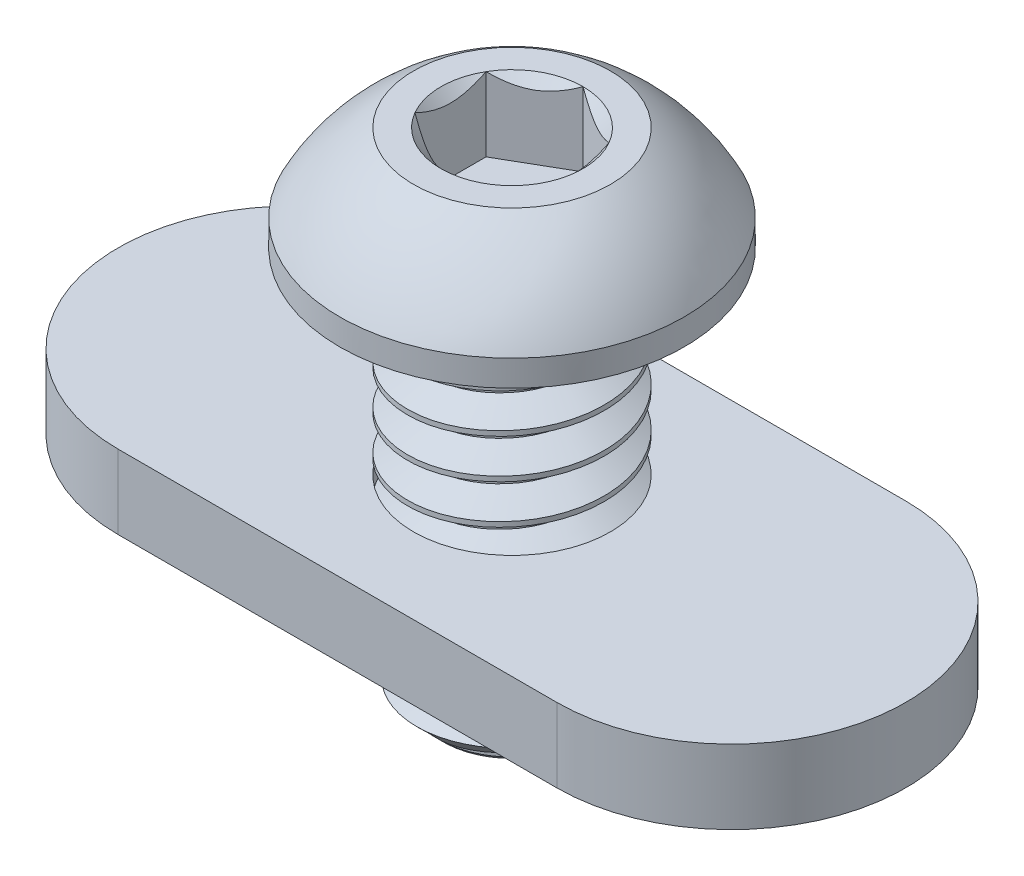
from build123d import *

# Parameters (mm, degrees)
SKETCH1_R           = 3.175
BOSS_EXTRUDE1_DEPTH = 12.7
CUT_SWEEP1_PITCH    = 1.27
SKETCH4_OUTSIDE_W   = 14
SKETCH4_OUTSIDE_H   = 14
SKETCH4_OUTSIDE_R   = 2.21262927
CUT_EXTRUDE1_DEPTH  = 1.27
CUT_EXTRUDE1_DRAFT  = -45
CUT_EXTRUDE2_DEPTH  = 2.38125
BOSS_EXTRUDE2_START = -6.35
SKETCH8_R           = 3.175
BOSS_EXTRUDE2_DEPTH = 2.3876
SKETCH9_R           = 3.5687
SKETCH9_R_2         = 3.175
BOSS_EXTRUDE3_DEPTH = 0.762


with BuildPart() as part:
    # Sketch1 → Boss-Extrude1 (new body)
    with BuildSketch(Plane(origin=(0, 0, 0), x_dir=(1, 0, 0), z_dir=(0, 1, 0))):
        with Locations(Location((0, 0, 0), (0, 0, 270))):
            Circle(SKETCH1_R)
    extrude(amount=-BOSS_EXTRUDE1_DEPTH)

    # Cut-Sweep1: the profile of Sketch3 screwed along a right-hand helix of 11 turns, 8 arcs to a turn; built about Z, then put on its axis
    cut_sweep1_z = Axis((0, 0, 0), (0, 0, 1))
    cut_sweep1_corners = [(2.350110803, 0, -0.47625), (3.243740766, 0, 0.0396875), (3.243740766, 0, -1.1509375), (2.350110803, 0, -0.635)]
    with BuildLine(mode=Mode.PRIVATE) as cut_sweep1_profile:
        Line(cut_sweep1_corners[0], cut_sweep1_corners[1])
        Line(cut_sweep1_corners[1], cut_sweep1_corners[2])
        Line(cut_sweep1_corners[2], cut_sweep1_corners[3])
        Line(cut_sweep1_corners[3], cut_sweep1_corners[0])
    cut_sweep1_cap = Face(cut_sweep1_profile.wire())
    cut_sweep1_turn_angles = [0, 22.5, 45, 67.5, 90, 112.5, 135, 157.5, 180, 202.5, 225, 247.5, 270, 292.5, 315, 337.5, 360]
    cut_sweep1_turn_weights = [1, 0.9238795325112867, 1, 0.9238795325112867, 1, 0.9238795325112867, 1, 0.9238795325112867, 1, 0.9238795325112867, 1, 0.9238795325112867, 1, 0.9238795325112867, 1, 0.9238795325112867, 1]
    cut_sweep1_turn_rails = [Edge.make_bspline([Vector(p[0], p[1], 0).rotate(cut_sweep1_z, cut_sweep1_turn_angles[k]) / cut_sweep1_turn_weights[k] + Vector(0, 0, p[2] + CUT_SWEEP1_PITCH * cut_sweep1_turn_angles[k] / 360) for k in range(17)], [0, 0, 0, 1, 1, 2, 2, 3, 3, 4, 4, 5, 5, 6, 6, 7, 7, 8, 8, 8], 2, cut_sweep1_turn_weights) for p in cut_sweep1_corners]
    cut_sweep1_turn_sides = [Face.make_surface_from_curves(cut_sweep1_turn_rails[p[0]], cut_sweep1_turn_rails[p[1]]) for p in [(0, 1), (1, 2), (2, 3), (3, 0)]]
    cut_sweep1 = Plane(origin=(0, -12.7, 0), x_dir=(0, 0, -1), z_dir=(0, 1, 0)) * Solid(Shell([*[p.moved(Location((0, 0, CUT_SWEEP1_PITCH * i))) for i in range(11) for p in cut_sweep1_turn_sides], cut_sweep1_cap, cut_sweep1_cap.rotate(cut_sweep1_z, 3960).moved(Location((0, 0, CUT_SWEEP1_PITCH * 3960 / 360)))]))
    add(cut_sweep1, mode=Mode.SUBTRACT)


with BuildPart() as cut_extrude1_tool:
    # Sketch4 outside → Cut-Extrude1 (with draft: the straight prism first)
    with BuildSketch(Plane.XZ.offset(12.7)):
        Rectangle(SKETCH4_OUTSIDE_W, SKETCH4_OUTSIDE_H)
        Circle(SKETCH4_OUTSIDE_R, mode=Mode.SUBTRACT)
    extrude(amount=-CUT_EXTRUDE1_DEPTH)
    # Cut-Extrude1: the draft: its side faces are tilted about the plane it starts from
    cut_extrude1_sides = [cut_extrude1_tool.faces().sort_by_distance(p)[0] for p in [
        (0, -12.065, -7),
        (7, -12.065, 0),
        (0, -12.065, 7),
        (-7, -12.065, 0),
        (-2.21262927, -12.065, 0),
    ]]
    draft(cut_extrude1_sides, Plane.XZ.offset(12.7), CUT_EXTRUDE1_DRAFT)


with BuildPart() as part_1:
    add(part.part)

    # Cut-Extrude1: cut by cut_extrude1_tool
    add(cut_extrude1_tool.part, mode=Mode.SUBTRACT)

    # Sketch5 → Revolve1 (revolve)
    with BuildSketch(Plane.XY, mode=Mode.PRIVATE) as revolve1_sk:
        with BuildLine():
            Line((0, 0), (0, 3.3528))
            Line((0, 3.3528), (-3.175, 3.3528))
            ThreePointArc((-3.175, 3.3528), (-4.540019085, 2.263204136), (-5.5499, 0.8382))
            Line((-5.5499, 0.8382), (-5.5499, 0))
            Line((-5.5499, 0), (0, 0))
        make_face()
    revolve(revolve1_sk.sketch.rotate(Axis((0, 0, 0), (0, 1, 0)), 270), axis=Axis((0, 0, 0), (0, 1, 0)))

    # Sketch6 → Cut-Extrude2 (cut)
    with BuildSketch(Plane(origin=(0, 3.3528, 0), x_dir=(1, 0, 0), z_dir=(0, 1, 0))):
        Polygon((0, 2.291358881), (-1.984375, 1.14567944), (-1.984375, -1.14567944), (0, -2.291358881), (1.984375, -1.14567944), (1.984375, 1.14567944), align=None)
    extrude(amount=-CUT_EXTRUDE2_DEPTH, mode=Mode.SUBTRACT)

    # Cut-Extrude3 cone 1 section (through the dimple's axis) → Cut-Extrude3 (revolve, cut)
    with BuildSketch(Plane(origin=(0, 3.3528, 0), x_dir=(0, 0, 1), z_dir=(1, 0, 0))):
        Polygon((0, 0), (2.291358881, 0), (0, 2.291358881), align=None)
    revolve(axis=Axis((0, 3.3528, 0), (0, -1, 0)), mode=Mode.SUBTRACT)


with BuildPart() as body_2:
    # Sketch8 → Boss-Extrude2 (new body)
    with BuildSketch(Plane(origin=(0, 0, 0), x_dir=(1, 0, 0), z_dir=(0, 1, 0)).offset(BOSS_EXTRUDE2_START)):
        with BuildLine():
            Line((-7.0739, 5.6261), (7.0739, 5.6261))
            ThreePointArc((7.0739, 5.6261), (12.7, 0), (7.0739, -5.6261))
            Line((7.0739, -5.6261), (-7.0739, -5.6261))
            ThreePointArc((-7.0739, -5.6261), (-12.7, 0), (-7.0739, 5.6261))
        make_face()
        with Locations(Location((0, 0, 0), (0, 0, 270))):
            Circle(SKETCH8_R, mode=Mode.SUBTRACT)
    extrude(amount=-BOSS_EXTRUDE2_DEPTH)

    # Sketch9 → Boss-Extrude3 (add)
    with BuildSketch(Plane.XZ.offset(8.7376)):
        with Locations(Location((0, 0, 0), (0, 0, 90))):
            Circle(SKETCH9_R)
        with Locations(Location((0, 0, 0), (0, 0, 90))):
            Circle(SKETCH9_R_2, mode=Mode.SUBTRACT)
    extrude(amount=BOSS_EXTRUDE3_DEPTH)


solid = Compound([part_1.part, body_2.part])
